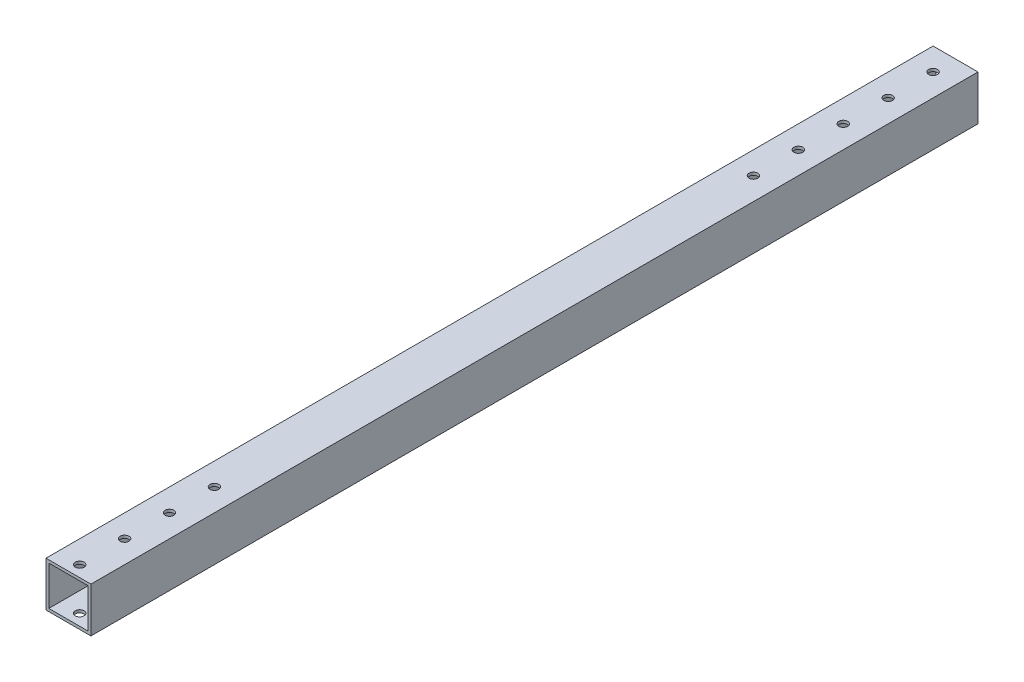
from build123d import *

# Parameters (mm, degrees)
SKETCH1_W               = 25.4
SKETCH1_H               = 25.4
BOSS_EXTRUDE1_DEPTH     = 250.825
SHELL1_T                = -1.5875
CUT_EXTRUDE1_DEPTH      = 252.467215806
CUT_EXTRUDE1_DEPTH_BACK = 252.467215806
SKETCH3_R               = 2.4892


with BuildPart() as part:
    # Sketch1 → Boss-Extrude1 (new, symmetric)
    with BuildSketch(Plane.XY):
        Rectangle(SKETCH1_W, SKETCH1_H)
    extrude(amount=BOSS_EXTRUDE1_DEPTH, both=True)

    # Shell1
    shell1_openings = [part.faces().sort_by_distance(p)[0] for p in [
        (0, 0, -250.825),
        (0, 0, 250.825),
    ]]
    offset(amount=SHELL1_T, openings=shell1_openings, kind=Kind.INTERSECTION)

    # Sketch3 → Cut-Extrude1 (cut, two sides: drawn at the far end of the back side and taken through both)
    with BuildSketch(Plane(origin=(0, 0, 0), x_dir=(1, 0, 0), z_dir=(0, 1, 0)).offset(-CUT_EXTRUDE1_DEPTH_BACK)):
        with Locations((0, 238.125)):
            Circle(SKETCH3_R)
        with Locations((0, 212.725)):
            Circle(SKETCH3_R)
        with Locations((0, 187.325)):
            Circle(SKETCH3_R)
        with Locations((0, 161.925)):
            Circle(SKETCH3_R)
        with Locations((0, 136.525)):
            Circle(SKETCH3_R)
        with Locations((0, -168.275)):
            Circle(SKETCH3_R)
        with Locations((0, -193.675)):
            Circle(SKETCH3_R)
        with Locations((0, -219.075)):
            Circle(SKETCH3_R)
        with Locations((0, -244.475)):
            Circle(SKETCH3_R)
    extrude(amount=CUT_EXTRUDE1_DEPTH + CUT_EXTRUDE1_DEPTH_BACK, mode=Mode.SUBTRACT)


solid = part.part
